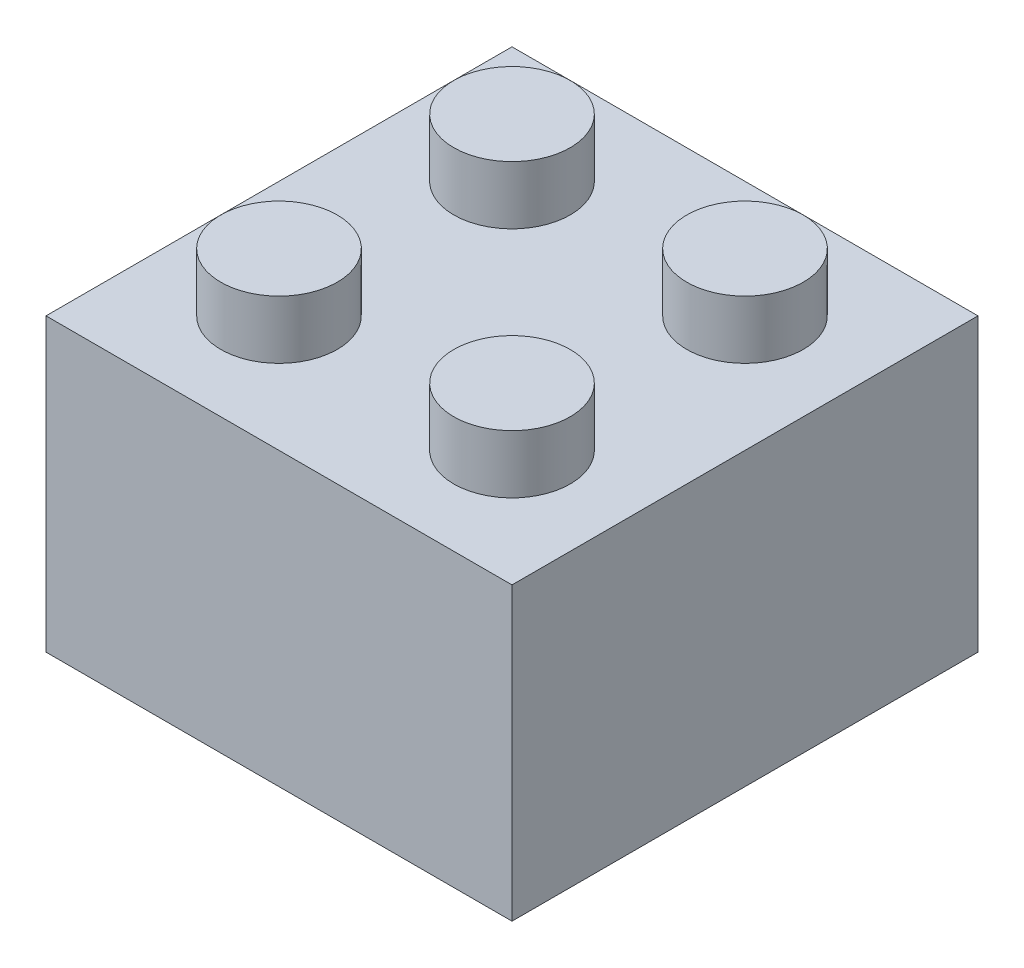
from build123d import *

# Parameters (mm, degrees)
SKETCH1_W           = 16
SKETCH1_H           = 16
BOSS_EXTRUDE1_DEPTH = 10
SKETCH2_R           = 2
BOSS_EXTRUDE2_DEPTH = 2
SHELL2_T            = -1
SKETCH3_R           = 2.7
SKETCH3_R_2         = 1.7
BOSS_EXTRUDE3_DEPTH = 9


with BuildPart() as part:
    # Sketch1 → Boss-Extrude1 (new body)
    with BuildSketch(Plane(origin=(0, 0, 0), x_dir=(1, 0, 0), z_dir=(0, 1, 0))):
        Rectangle(SKETCH1_W, SKETCH1_H)
    extrude(amount=BOSS_EXTRUDE1_DEPTH)

    # Sketch2 → Boss-Extrude2 (add)
    with BuildSketch(Plane(origin=(0, 10, 0), x_dir=(1, 0, 0), z_dir=(0, 1, 0))):
        with Locations((-4, 4)):
            Circle(SKETCH2_R)
        with Locations((4, 4)):
            Circle(SKETCH2_R)
        with Locations((4, -4)):
            Circle(SKETCH2_R)
        with Locations((-4, -4)):
            Circle(SKETCH2_R)
    extrude(amount=BOSS_EXTRUDE2_DEPTH)

    # Shell2
    shell2_openings = [part.faces().sort_by_distance(p)[0] for p in [
        (0, 0, 0),
    ]]
    offset(amount=SHELL2_T, openings=shell2_openings, kind=Kind.INTERSECTION)

    # Sketch3 → Boss-Extrude3 (add)
    with BuildSketch(Plane.XZ.offset(-9)):
        Circle(SKETCH3_R)
        Circle(SKETCH3_R_2, mode=Mode.SUBTRACT)
    extrude(amount=BOSS_EXTRUDE3_DEPTH)


solid = part.part
